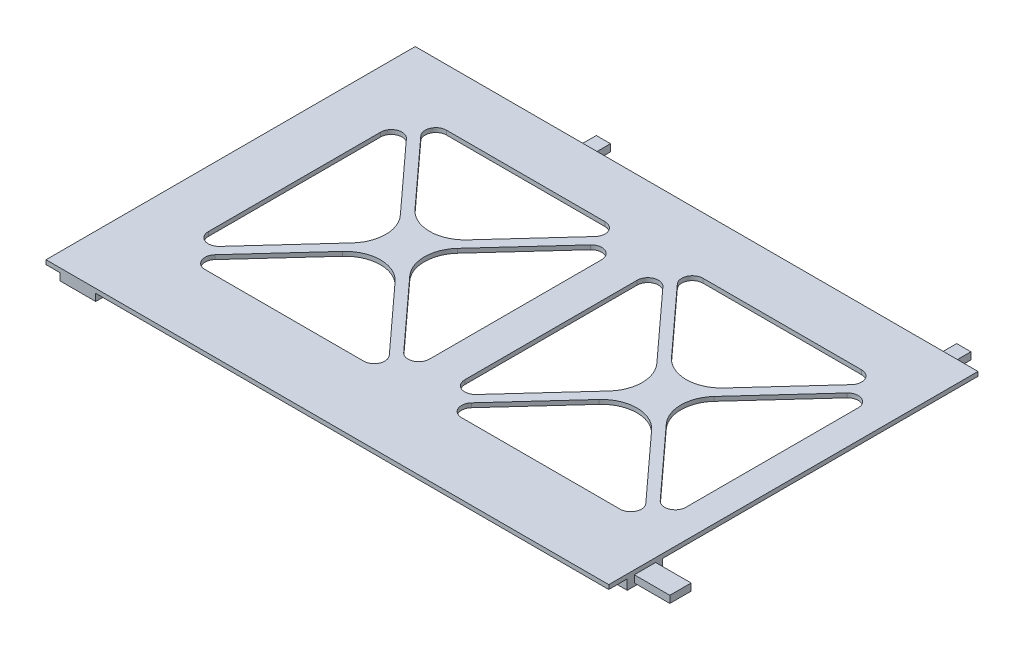
from build123d import *

# Parameters (mm, degrees)
SKETCH1_W           = 158.5
SKETCH1_H           = 104
SKETCH1_W_2         = 62.25
SKETCH1_H_2         = 68
BOSS_EXTRUDE1_DEPTH = 1.2
SKETCH2_W           = 4
SKETCH2_H           = 10
BOSS_EXTRUDE2_DEPTH = 2
FILLET1_R           = 2
SKETCH3_W           = 10
SKETCH3_H           = 9
BOSS_EXTRUDE3_DEPTH = 5
SKETCH4_R           = 1.3
CUT_EXTRUDE1_DEPTH  = 5
CUT_EXTRUDE2_DEPTH  = 3.8
FILLET2_R           = 5
FILLET3_R           = 2
SKETCH6_W           = 98
SKETCH6_H           = 10
BOSS_EXTRUDE4_DEPTH = 0.8
SKETCH8_W           = 16
SKETCH8_H           = 6
BOSS_EXTRUDE5_DEPTH = 2
SKETCH9_W           = 6
SKETCH9_H           = 10
SKETCH9_W_2         = 3
SKETCH9_H_2         = 9.8
BOSS_EXTRUDE6_DEPTH = 2.8
FILLET4_R           = 3
SKETCH11_W          = 10
SKETCH11_H          = 71
BOSS_EXTRUDE7_DEPTH = 2
BOSS_EXTRUDE8_DEPTH = 1.2


# Some blends are built 0.0001 mm under size
with BuildPart() as part:
    # Sketch1 → Boss-Extrude1 (new body)
    with BuildSketch(Plane(origin=(0, 0, 0), x_dir=(1, 0, 0), z_dir=(0, 1, 0))):
        with Locations((79.25, 52)):
            Rectangle(SKETCH1_W, SKETCH1_H)
        with Locations((119.375, 54)):
            Rectangle(SKETCH1_W_2, SKETCH1_H_2, mode=Mode.SUBTRACT)
        with Locations((47.125, 54)):
            Rectangle(SKETCH1_W_2, SKETCH1_H_2, mode=Mode.SUBTRACT)
    extrude(amount=BOSS_EXTRUDE1_DEPTH)

    # Sketch2 → Boss-Extrude2 (add)
    with BuildSketch(Plane.XZ):
        with Locations((149.5, -104)):
            Rectangle(SKETCH2_W, SKETCH2_H)
        with Locations((48, -104)):
            Rectangle(SKETCH2_W, SKETCH2_H)
    extrude(amount=BOSS_EXTRUDE2_DEPTH)

    # Fillet1
    fillet1_edges = [part.edges().sort_by_distance(p)[0] for p in [
        (50, 0, -101.5),
        (46, 0, -101.5),
        (147.5, 0, -101.5),
        (151.5, 0, -101.5),
    ]]
    fillet(fillet1_edges, radius=FILLET1_R - 0.0001)  # a hair under: the kernel refuses the full size

    # Sketch3 → Boss-Extrude3 (add)
    with BuildSketch(Plane(origin=(0, 0, -104), x_dir=(-1, 0, 0), z_dir=(0, 0, -1))):
        with Locations((-95.75, -3.3)):
            Rectangle(SKETCH3_W, SKETCH3_H)
    extrude(amount=-BOSS_EXTRUDE3_DEPTH)

    # Sketch4 → Cut-Extrude1 (cut)
    with BuildSketch(Plane(origin=(0, 0, -104), x_dir=(-1, 0, 0), z_dir=(0, 0, -1))):
        with Locations((-95.75, -3.3)):
            Circle(SKETCH4_R)
    extrude(amount=-CUT_EXTRUDE1_DEPTH, mode=Mode.SUBTRACT)

    # Sketch5 → Cut-Extrude2 (cut)
    with BuildSketch(Plane.XY.offset(-99)):
        with BuildLine():
            Line((92.25, -3.3), (92.25, -7.8))
            Line((92.25, -7.8), (99.25, -7.8))
            Line((99.25, -7.8), (99.25, -3.3))
            ThreePointArc((99.25, -3.3), (95.75, 0.2), (92.25, -3.3))
        make_face()
    extrude(amount=-CUT_EXTRUDE2_DEPTH, mode=Mode.SUBTRACT)

    # Fillet2
    fillet2_edges = [part.edges().sort_by_distance(p)[0] for p in [
        (100.75, 0, -101.5),
        (90.75, 0, -101.5),
    ]]
    fillet(fillet2_edges, radius=FILLET2_R)

    # Fillet3
    fillet3_edges = [part.edges().sort_by_distance(p)[0] for p in [
        (90.75, -7.8, -101.5),
        (100.75, -7.8, -101.5),
    ]]
    fillet(fillet3_edges, radius=FILLET3_R)

    # Sketch6 → Boss-Extrude4 (add)
    with BuildSketch(Plane.XZ):
        with Locations((109.5, -10.2)):
            Rectangle(SKETCH6_W, SKETCH6_H)
    extrude(amount=BOSS_EXTRUDE4_DEPTH)

    # Sketch8 → Boss-Extrude5 (add)
    with BuildSketch(Plane.XZ):
        with Locations((160.5, -10.2)):
            Rectangle(SKETCH8_W, SKETCH8_H)
    extrude(amount=BOSS_EXTRUDE5_DEPTH)

    # Sketch9 → Boss-Extrude6 (add)
    with BuildSketch(Plane.XZ):
        with Locations((155.5, -10.2)):
            Rectangle(SKETCH9_W, SKETCH9_H)
        with Locations((59, -10.1)):
            Rectangle(SKETCH9_W_2, SKETCH9_H_2)
    extrude(amount=BOSS_EXTRUDE6_DEPTH)

    # Fillet4
    # the kernel refuses this fillet: 3 mm, written as the material it adds along each edge
    with BuildSketch(Plane(origin=(57.5, 0, -5.2), x_dir=(-1, 0, 0), z_dir=(0, 0, -1))) as fillet4_piece_1:
        with BuildLine():
            CenterArc((2.993325909, -3), FILLET4_R, 90, 86.177446271)
            Line((0, -2.8), (-0.059866518, -2.796))
            ThreePointArc((-0.059866518, -2.796), (-0.06, -1.4), (-0.06, 0))
            Line((-0.06, 0), (0, 0.06))
            Line((0, 0.06), (2.993325909, 0.06))
            Line((2.993325909, 0.06), (2.993325909, 0))
        make_face()
    extrude(amount=9.8)

    # Sketch11 → Boss-Extrude7 (add)
    with BuildSketch(Plane.XZ):
        with Locations((9, -35.5)):
            Rectangle(SKETCH11_W, SKETCH11_H)
    extrude(amount=BOSS_EXTRUDE7_DEPTH)

    # Sketch12 → Boss-Extrude8 (add)
    with BuildSketch(Plane(origin=(0, 1.2, 0), x_dir=(1, 0, 0), z_dir=(0, 1, 0))):
        with BuildLine():
            Line((22.585033293, 82.977390915), (39.739539441, 64.185732728))
            ThreePointArc((39.739539441, 64.185732728), (47.125, 60.927763011), (54.510460559, 64.185732728))
            Line((54.510460559, 64.185732728), (71.664966707, 82.977390915))
            ThreePointArc((71.664966707, 82.977390915), (72.194126096, 86.210820537), (69.449328539, 88))
            Line((69.449328539, 88), (53.452699296, 88))
            Line((53.452699296, 88), (53.452699296, 91.208733434))
            Line((53.452699296, 91.208733434), (81.121703178, 91.208733434))
            Line((81.121703178, 91.208733434), (81.121703178, 63.398815268))
            Line((81.121703178, 63.398815268), (78.25, 63.398815268))
            Line((78.25, 63.398815268), (78.25, 78.263994748))
            ThreePointArc((78.25, 78.263994748), (76.334685553, 81.061039126), (73.034361832, 80.286603833))
            Line((73.034361832, 80.286603833), (55.19253522, 60.742030283))
            ThreePointArc((55.19253522, 60.742030283), (52.577995779, 54), (55.19253522, 47.257969717))
            Line((55.19253522, 47.257969717), (73.034361832, 27.713396167))
            ThreePointArc((73.034361832, 27.713396167), (76.334685553, 26.938960874), (78.25, 29.736005252))
            Line((78.25, 29.736005252), (78.25, 51.032908731))
            Line((78.25, 51.032908731), (81.121703178, 51.032908731))
            Line((81.121703178, 51.032908731), (81.121703178, 16.832253351))
            Line((81.121703178, 16.832253351), (49.123041709, 16.832253351))
            Line((49.123041709, 16.832253351), (49.123041709, 20))
            Line((49.123041709, 20), (69.449328539, 20))
            ThreePointArc((69.449328539, 20), (72.194126096, 21.789179463), (71.664966707, 25.022609085))
            Line((71.664966707, 25.022609085), (54.510460559, 43.814267272))
            ThreePointArc((54.510460559, 43.814267272), (47.125, 47.072236989), (39.739539441, 43.814267272))
            Line((39.739539441, 43.814267272), (22.585033293, 25.022609085))
            ThreePointArc((22.585033293, 25.022609085), (22.055873904, 21.789179463), (24.800671461, 20))
            Line((24.800671461, 20), (42.917495227, 20))
            Line((42.917495227, 20), (42.917495227, 16.832253351))
            Line((42.917495227, 16.832253351), (11.408469589, 16.832253351))
            Line((11.408469589, 16.832253351), (11.408469589, 46.938752597))
            Line((11.408469589, 46.938752597), (16, 46.938752597))
            Line((16, 46.938752597), (16, 29.736005252))
            ThreePointArc((16, 29.736005252), (17.915314447, 26.938960874), (21.215638168, 27.713396167))
            Line((21.215638168, 27.713396167), (39.05746478, 47.257969717))
            ThreePointArc((39.05746478, 47.257969717), (41.672004221, 54), (39.05746478, 60.742030283))
            Line((39.05746478, 60.742030283), (21.215638168, 80.286603833))
            ThreePointArc((21.215638168, 80.286603833), (17.915314447, 81.061039126), (16, 78.263994748))
            Line((16, 78.263994748), (16, 63.398815268))
            Line((16, 63.398815268), (11.408469589, 63.398815268))
            Line((11.408469589, 63.398815268), (11.408469589, 91.208733434))
            Line((11.408469589, 91.208733434), (44.179781607, 91.208733434))
            Line((44.179781607, 91.208733434), (44.179781607, 88))
            Line((44.179781607, 88), (24.800671461, 88))
            ThreePointArc((24.800671461, 88), (22.055873904, 86.210820537), (22.585033293, 82.977390915))
        make_face()
    boss_extrude8 = extrude(amount=-BOSS_EXTRUDE8_DEPTH)

    # Mirror1: Boss-Extrude8 across plane
    add(boss_extrude8.mirror(Plane(origin=(83.25, 0, 0), x_dir=(0, 0, 1), z_dir=(1, 0, 0))))


solid = part.part
